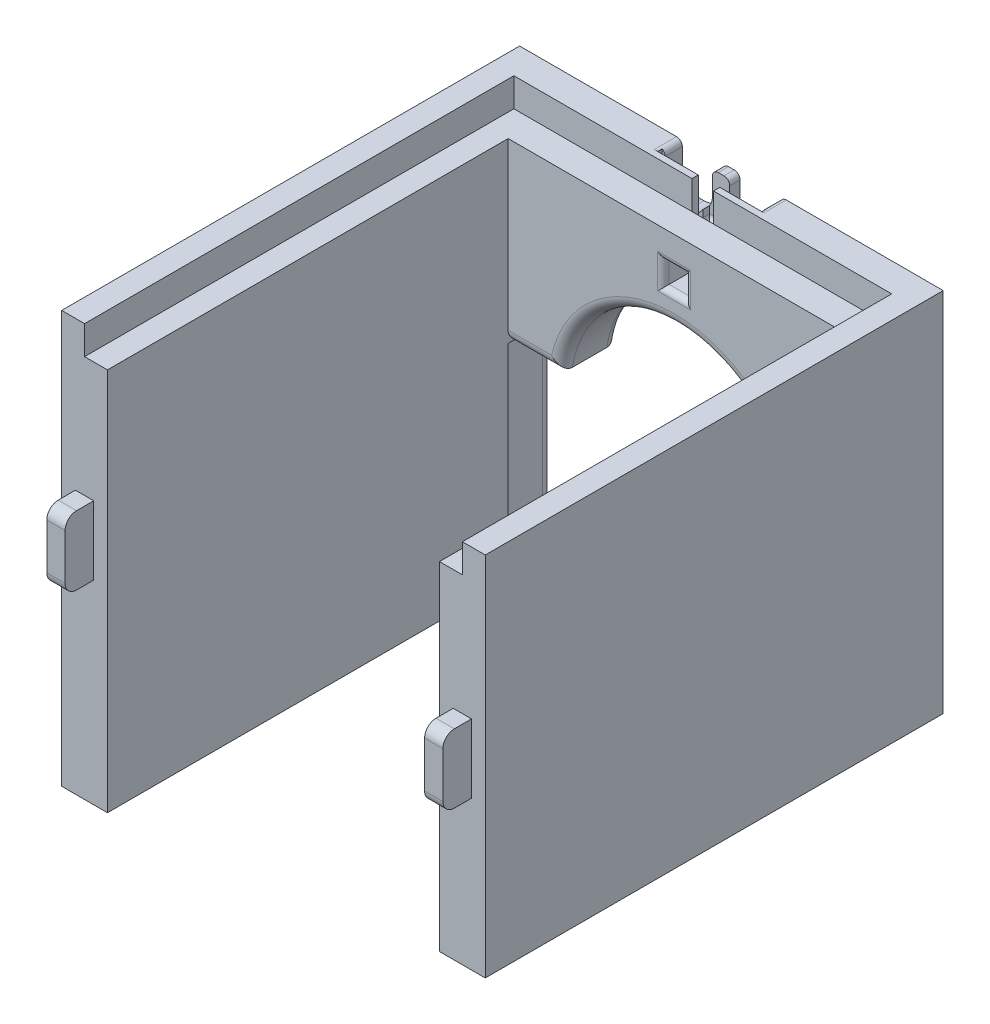
from build123d import *

# Parameters (mm, degrees)
SKETCH1_W            = 185
SKETCH1_H            = 160
BOSS_EXTRUDE1_DEPTH  = 25
SKETCH2_W            = 20
SKETCH2_H            = 160
BOSS_EXTRUDE2_DEPTH  = 175
SKETCH5_W            = 20
SKETCH5_H            = 200
BOSS_EXTRUDE3_DEPTH  = 20
CUT_EXTRUDE1_DEPTH   = 25
SKETCH6_W            = 5
SKETCH6_H            = 25
CUT_EXTRUDE2_DEPTH   = 20
FILLET2_R            = 5
SKETCH7_W            = 8
SKETCH7_H            = 30
BOSS_EXTRUDE4_DEPTH  = 12.5
FILLET3_R            = 5
FILLET3_OF_MIRROR1_R = 5
SKETCH8_W            = 165
SKETCH8_H            = 187.5
CUT_EXTRUDE3_DEPTH   = 12.5
SKETCH10_R           = 8.25
CUT_EXTRUDE4_DEPTH   = 7.5
CUT_EXTRUDE5_DEPTH   = 20
SKETCH12_W           = 17.688824297
SKETCH12_H           = 7.5
CUT_EXTRUDE6_DEPTH   = 18.25
FILLET4_R            = 8.25
FILLET4_OF_MIRROR2_R = 8.25
SKETCH14_W           = 9.39420862
SKETCH14_H           = 3
CUT_EXTRUDE7_DEPTH   = 35
SKETCH15_W           = 9.39420862
SKETCH15_H           = 10
CUT_EXTRUDE8_DEPTH   = 30
FILLET5_R            = 2.5


with BuildPart() as part:
    # Sketch1 → Boss-Extrude1 (new body)
    with BuildSketch(Plane.XY):
        with Locations((92.5, 80)):
            Rectangle(SKETCH1_W, SKETCH1_H)
    extrude(amount=BOSS_EXTRUDE1_DEPTH)

    # Sketch2 → Boss-Extrude2 (add)
    with BuildSketch(Plane.XY.offset(25)):
        with Locations((10, 80)):
            Rectangle(SKETCH2_W, SKETCH2_H)
        with Locations((175, 80)):
            Rectangle(SKETCH2_W, SKETCH2_H)
    extrude(amount=BOSS_EXTRUDE2_DEPTH)

    # Sketch5 → Boss-Extrude3 (add)
    with BuildSketch(Plane.XZ):
        with Locations((10, 100)):
            Rectangle(SKETCH5_W, SKETCH5_H)
    extrude(amount=BOSS_EXTRUDE3_DEPTH)

    # Sketch3 → Cut-Extrude1 (cut)
    with BuildSketch(Plane(origin=(0, 0, 0), x_dir=(-1, 0, 0), z_dir=(0, 0, -1))):
        with BuildLine():
            Line((-170, 0), (-15, 0))
            Line((-15, 0), (-15, 70))
            Line((-15, 70), (-43.065700167, 70))
            ThreePointArc((-43.065700167, 70), (-92.5, 112.5), (-141.934299833, 70))
            Line((-141.934299833, 70), (-170, 70))
            Line((-170, 70), (-170, 0))
        make_face()
    extrude(amount=-CUT_EXTRUDE1_DEPTH, mode=Mode.SUBTRACT)

    # Sketch6 → Cut-Extrude2 (cut)
    with BuildSketch(Plane(origin=(0, 0, 0), x_dir=(1, 0, 0), z_dir=(0, 1, 0))):
        with Locations((17.5, -12.5)):
            Rectangle(SKETCH6_W, SKETCH6_H)
    extrude(amount=-CUT_EXTRUDE2_DEPTH, mode=Mode.SUBTRACT)

    # Fillet2
    fillet2_edges = [part.edges().sort_by_distance(p)[0] for p in [
        (153.467149917, 70, 25),
        (92.5, 112.5, 25),
        (31.532850083, 70, 25),
        (170, 35, 0),
        (15, 25, 0),
        (29.032850083, 70, 0),
        (92.5, 112.5, 0),
        (155.967149917, 70, 0),
    ]]
    fillet(fillet2_edges, radius=FILLET2_R)

    # Sketch7 → Boss-Extrude4 (add)
    with BuildSketch(Plane.XY.offset(200)):
        with Locations((175, 80)):
            Rectangle(SKETCH7_W, SKETCH7_H)
    boss_extrude4 = extrude(amount=BOSS_EXTRUDE4_DEPTH)

    # Fillet3
    fillet3_edges = [part.edges().sort_by_distance(p)[0] for p in [
        (175, 95, 212.5),
        (175, 65, 212.5),
    ]]
    fillet(fillet3_edges, radius=FILLET3_R)

    # Mirror1: Boss-Extrude4 across plane
    add(boss_extrude4.mirror(Plane.ZY.offset(-92.5)))

    # Fillet3 of Mirror1
    fillet3_of_mirror1_edges = [part.edges().sort_by_distance(p)[0] for p in [
        (10, 95, 212.5),
        (10, 65, 212.5),
    ]]
    fillet(fillet3_of_mirror1_edges, radius=FILLET3_OF_MIRROR1_R)

    # Sketch8 → Cut-Extrude3 (cut)
    with BuildSketch(Plane(origin=(0, 160, 0), x_dir=(1, 0, 0), z_dir=(0, 1, 0))):
        with Locations((92.5, -106.25)):
            Rectangle(SKETCH8_W, SKETCH8_H)
    extrude(amount=-CUT_EXTRUDE3_DEPTH, mode=Mode.SUBTRACT)

    # Sketch10 → Cut-Extrude4 (cut)
    with BuildSketch(Plane(origin=(0, 0, 0), x_dir=(-1, 0, 0), z_dir=(0, 0, -1))):
        with Locations((-105, 150)):
            Circle(SKETCH10_R)
        with Locations(Location((-80, 150, 0), (0, 0, 180))):
            Circle(SKETCH10_R)
    extrude(amount=-CUT_EXTRUDE4_DEPTH, mode=Mode.SUBTRACT)

    # Sketch11 → Cut-Extrude5 (cut)
    with BuildSketch(Plane(origin=(0, 160, 0), x_dir=(1, 0, 0), z_dir=(0, 1, 0))):
        Polygon((87.5, -7.5), (69.75, -7.5), (69.75, -9.75), (115.25, -9.75), (115.25, -7.5), (97.5, -7.5), (97.5, -4.5), (87.5, -4.5), align=None)
    extrude(amount=-CUT_EXTRUDE5_DEPTH, mode=Mode.SUBTRACT)

    # Sketch12 → Cut-Extrude6 (cut)
    with BuildSketch(Plane(origin=(0, 160, 0), x_dir=(1, 0, 0), z_dir=(0, 1, 0))):
        with Locations((105.102762798, -3.75)):
            Rectangle(SKETCH12_W, SKETCH12_H)
    cut_extrude6 = extrude(amount=-CUT_EXTRUDE6_DEPTH, mode=Mode.SUBTRACT)

    # Fillet4
    fillet4_edges = [part.edges().sort_by_distance(p)[0] for p in [
        (96.258350649, 141.75, 2.25),
        (113.947174946, 141.75, 3.75),
    ]]
    fillet(fillet4_edges, radius=FILLET4_R)

    # Mirror2: Cut-Extrude6 across plane
    add(cut_extrude6.mirror(Plane.ZY.offset(-92.5)), mode=Mode.SUBTRACT)

    # Fillet4 of Mirror2
    fillet4_of_mirror2_edges = [part.edges().sort_by_distance(p)[0] for p in [
        (88.741649351, 141.75, 2.25),
        (71.052825054, 141.75, 3.75),
    ]]
    fillet(fillet4_of_mirror2_edges, radius=FILLET4_OF_MIRROR2_R)

    # Sketch14 → Cut-Extrude7 (cut)
    with BuildSketch(Plane(origin=(0, 160, 0), x_dir=(1, 0, 0), z_dir=(0, 1, 0))):
        with Locations((92.5, -11)):
            Rectangle(SKETCH14_W, SKETCH14_H)
    extrude(amount=-CUT_EXTRUDE7_DEPTH, mode=Mode.SUBTRACT)

    # Sketch15 → Cut-Extrude8 (cut)
    with BuildSketch(Plane(origin=(0, 0, 12.5), x_dir=(-1, 0, 0), z_dir=(0, 0, -1))):
        with Locations((-92.5, 130)):
            Rectangle(SKETCH15_W, SKETCH15_H)
    extrude(amount=-CUT_EXTRUDE8_DEPTH, mode=Mode.SUBTRACT)

    # Fillet5
    # the kernel refuses this fillet: 2.5 mm, written as the material it adds along each edge
    with BuildSketch(Plane(origin=(87.5, 140, 4.5), x_dir=(0, 1, 0), z_dir=(0, 0, 1)), Plane(origin=(97.5, 140, 7.5), x_dir=(0, 1, 0), z_dir=(0, 0, -1))) as fillet5_piece_1:
        with BuildLine():
            CenterArc((FILLET5_R, -FILLET5_R), FILLET5_R, 90, 90)
            Line((0, -FILLET5_R), (0, 0))
            Line((0, 0), (FILLET5_R, 0))
        make_face()
    extrude(amount=3)
    with BuildSketch(Plane(origin=(97.5, 140, 4.5), x_dir=(0, 1, 0), z_dir=(-1, 0, 0))) as fillet5_piece_2:
        with BuildLine():
            CenterArc((FILLET5_R, -FILLET5_R), FILLET5_R, 90, 90)
            Line((0, -FILLET5_R), (0, 0))
            Line((0, 0), (FILLET5_R, 0))
        make_face()
    extrude(amount=10)
    with BuildSketch(Plane(origin=(103.44710431, 125, 9.5), x_dir=(0, 1, 0), z_dir=(-1, 0, 0))) as fillet5_piece_3:
        with BuildLine():
            CenterArc((FILLET5_R, -FILLET5_R), FILLET5_R, 90, 90)
            Line((0, -FILLET5_R), (0, 0))
            Line((0, 0), (FILLET5_R, 0))
        make_face()
    extrude(amount=21.89420862)
    # the kernel refuses this fillet: 2.5 mm, written as the material it takes off along each edge
    with BuildSketch(Plane(origin=(96.258350649, 160, 10.75), x_dir=(0, -1, 0), z_dir=(0, 0, -1)), Plane(origin=(88.741649351, 160, 10.75), x_dir=(1, 0, 0), z_dir=(0, 0, -1))) as fillet5_2_piece_1:
        with BuildLine():
            CenterArc((FILLET5_R, FILLET5_R), FILLET5_R, 180, 90)
            Line((0, FILLET5_R), (0, 0))
            Line((0, 0), (FILLET5_R, 0))
        make_face()
    extrude(amount=17, mode=Mode.SUBTRACT)
    with BuildSketch(Plane(origin=(113.947174946, 160, -6.25), x_dir=(1, 0, 0), z_dir=(0, 0, 1))) as fillet5_2_piece_2_section:
        with BuildLine():
            CenterArc((FILLET5_R, -FILLET5_R), FILLET5_R, 90, 90)
            Line((0, -FILLET5_R), (0, 0))
            Line((0, 0), (FILLET5_R, 0))
        make_face()
    fillet5_2_piece_2 = extrude(amount=20, mode=Mode.PRIVATE)
    fillet5_2_piece_2 = split(fillet5_2_piece_2, bisect_by=Plane(origin=(113.947174946, 160, 9.75), z_dir=(0, 0, -1)), keep=Keep.TOP, mode=Mode.PRIVATE)
    add(fillet5_2_piece_2, mode=Mode.SUBTRACT)
    with BuildSketch(Plane(origin=(71.052825054, 160, -6.25), x_dir=(-1, 0, 0), z_dir=(0, 0, 1))) as fillet5_2_piece_3_section:
        with BuildLine():
            CenterArc((FILLET5_R, FILLET5_R), FILLET5_R, 180, 90)
            Line((0, FILLET5_R), (0, 0))
            Line((0, 0), (FILLET5_R, 0))
        make_face()
    fillet5_2_piece_3 = extrude(amount=20, mode=Mode.PRIVATE)
    fillet5_2_piece_3 = split(fillet5_2_piece_3, bisect_by=Plane(origin=(71.052825054, 160, 9.75), z_dir=(0, 0, -1)), keep=Keep.TOP, mode=Mode.PRIVATE)
    add(fillet5_2_piece_3, mode=Mode.SUBTRACT)
    with BuildSketch(Plane(origin=(97.19710431, 125, 25), x_dir=(0, 0, -1), z_dir=(0, 1, 0)), Plane(origin=(87.80289569, 135, 25), x_dir=(0, 0, -1), z_dir=(0, -1, 0))) as fillet5_2_piece_4:
        with BuildLine():
            CenterArc((FILLET5_R, -FILLET5_R), FILLET5_R, 90, 90)
            Line((0, -FILLET5_R), (0, 0))
            Line((0, 0), (FILLET5_R, 0))
        make_face()
    extrude(amount=10, mode=Mode.SUBTRACT)
    with BuildSketch(Plane(origin=(97.19710431, 135, 25), x_dir=(0, 0, -1), z_dir=(-1, 0, 0)), Plane(origin=(87.80289569, 125, 25), x_dir=(0, 0, -1), z_dir=(1, 0, 0))) as fillet5_2_piece_5:
        with BuildLine():
            CenterArc((FILLET5_R, -FILLET5_R), FILLET5_R, 90, 90)
            Line((0, -FILLET5_R), (0, 0))
            Line((0, 0), (FILLET5_R, 0))
        make_face()
    extrude(amount=9.39420862, mode=Mode.SUBTRACT)
    with BuildSketch(Plane(origin=(97.19710431, 118.75, 25), x_dir=(0, 0, -1), z_dir=(0, 1, 0))) as fillet5_2_piece_6a_section:
        with BuildLine():
            CenterArc((FILLET5_R, -FILLET5_R), FILLET5_R, 90, 90)
            Line((0, -FILLET5_R), (0, 0))
            Line((0, 0), (FILLET5_R, 0))
        make_face()
    fillet5_2_piece_6a = extrude(amount=16.25, mode=Mode.PRIVATE)
    fillet5_2_piece_6a = split(fillet5_2_piece_6a, bisect_by=Plane(origin=(97.19710431, 125, 25), z_dir=(0, -1, 0)), keep=Keep.TOP, mode=Mode.PRIVATE)
    with BuildSketch(Plane(origin=(87.80289569, 125, 25), x_dir=(0, 0, -1), z_dir=(1, 0, 0))) as fillet5_2_piece_6b_section:
        with BuildLine():
            CenterArc((FILLET5_R, -FILLET5_R), FILLET5_R, 90, 90)
            Line((0, -FILLET5_R), (0, 0))
            Line((0, 0), (FILLET5_R, 0))
        make_face()
    fillet5_2_piece_6b = extrude(amount=15.64420862, mode=Mode.PRIVATE)
    fillet5_2_piece_6b = split(fillet5_2_piece_6b, bisect_by=Plane(origin=(97.19710431, 125, 25), z_dir=(1, 0, 0)), keep=Keep.TOP, mode=Mode.PRIVATE)
    fillet5_2_piece_6 = fillet5_2_piece_6a & fillet5_2_piece_6b
    add(fillet5_2_piece_6, mode=Mode.SUBTRACT)
    with BuildSketch(Plane(origin=(97.19710431, 125, 25), x_dir=(0, 0, -1), z_dir=(0, 1, 0))) as fillet5_2_piece_7a_section:
        with BuildLine():
            CenterArc((FILLET5_R, -FILLET5_R), FILLET5_R, 90, 90)
            Line((0, -FILLET5_R), (0, 0))
            Line((0, 0), (FILLET5_R, 0))
        make_face()
    fillet5_2_piece_7a = extrude(amount=16.25, mode=Mode.PRIVATE)
    fillet5_2_piece_7a = split(fillet5_2_piece_7a, bisect_by=Plane(origin=(97.19710431, 135, 25), z_dir=(0, 1, 0)), keep=Keep.TOP, mode=Mode.PRIVATE)
    with BuildSketch(Plane(origin=(103.44710431, 135, 25), x_dir=(0, 0, -1), z_dir=(-1, 0, 0))) as fillet5_2_piece_7b_section:
        with BuildLine():
            CenterArc((FILLET5_R, -FILLET5_R), FILLET5_R, 90, 90)
            Line((0, -FILLET5_R), (0, 0))
            Line((0, 0), (FILLET5_R, 0))
        make_face()
    fillet5_2_piece_7b = extrude(amount=15.64420862, mode=Mode.PRIVATE)
    fillet5_2_piece_7b = split(fillet5_2_piece_7b, bisect_by=Plane(origin=(97.19710431, 135, 25), z_dir=(1, 0, 0)), keep=Keep.TOP, mode=Mode.PRIVATE)
    fillet5_2_piece_7 = fillet5_2_piece_7a & fillet5_2_piece_7b
    add(fillet5_2_piece_7, mode=Mode.SUBTRACT)
    with BuildSketch(Plane(origin=(97.19710431, 135, 25), x_dir=(0, 0, -1), z_dir=(-1, 0, 0))) as fillet5_2_piece_8a_section:
        with BuildLine():
            CenterArc((FILLET5_R, -FILLET5_R), FILLET5_R, 90, 90)
            Line((0, -FILLET5_R), (0, 0))
            Line((0, 0), (FILLET5_R, 0))
        make_face()
    fillet5_2_piece_8a = extrude(amount=15.64420862, mode=Mode.PRIVATE)
    fillet5_2_piece_8a = split(fillet5_2_piece_8a, bisect_by=Plane(origin=(87.80289569, 135, 25), z_dir=(-1, 0, 0)), keep=Keep.TOP, mode=Mode.PRIVATE)
    with BuildSketch(Plane(origin=(87.80289569, 141.25, 25), x_dir=(0, 0, -1), z_dir=(0, -1, 0))) as fillet5_2_piece_8b_section:
        with BuildLine():
            CenterArc((FILLET5_R, -FILLET5_R), FILLET5_R, 90, 90)
            Line((0, -FILLET5_R), (0, 0))
            Line((0, 0), (FILLET5_R, 0))
        make_face()
    fillet5_2_piece_8b = extrude(amount=16.25, mode=Mode.PRIVATE)
    fillet5_2_piece_8b = split(fillet5_2_piece_8b, bisect_by=Plane(origin=(87.80289569, 135, 25), z_dir=(0, 1, 0)), keep=Keep.TOP, mode=Mode.PRIVATE)
    fillet5_2_piece_8 = fillet5_2_piece_8a & fillet5_2_piece_8b
    add(fillet5_2_piece_8, mode=Mode.SUBTRACT)
    with BuildSketch(Plane(origin=(87.80289569, 135, 25), x_dir=(0, 0, -1), z_dir=(0, -1, 0))) as fillet5_2_piece_9a_section:
        with BuildLine():
            CenterArc((FILLET5_R, -FILLET5_R), FILLET5_R, 90, 90)
            Line((0, -FILLET5_R), (0, 0))
            Line((0, 0), (FILLET5_R, 0))
        make_face()
    fillet5_2_piece_9a = extrude(amount=16.25, mode=Mode.PRIVATE)
    fillet5_2_piece_9a = split(fillet5_2_piece_9a, bisect_by=Plane(origin=(87.80289569, 125, 25), z_dir=(0, -1, 0)), keep=Keep.TOP, mode=Mode.PRIVATE)
    with BuildSketch(Plane(origin=(81.55289569, 125, 25), x_dir=(0, 0, -1), z_dir=(1, 0, 0))) as fillet5_2_piece_9b_section:
        with BuildLine():
            CenterArc((FILLET5_R, -FILLET5_R), FILLET5_R, 90, 90)
            Line((0, -FILLET5_R), (0, 0))
            Line((0, 0), (FILLET5_R, 0))
        make_face()
    fillet5_2_piece_9b = extrude(amount=15.64420862, mode=Mode.PRIVATE)
    fillet5_2_piece_9b = split(fillet5_2_piece_9b, bisect_by=Plane(origin=(87.80289569, 125, 25), z_dir=(-1, 0, 0)), keep=Keep.TOP, mode=Mode.PRIVATE)
    fillet5_2_piece_9 = fillet5_2_piece_9a & fillet5_2_piece_9b
    add(fillet5_2_piece_9, mode=Mode.SUBTRACT)


solid = part.part
